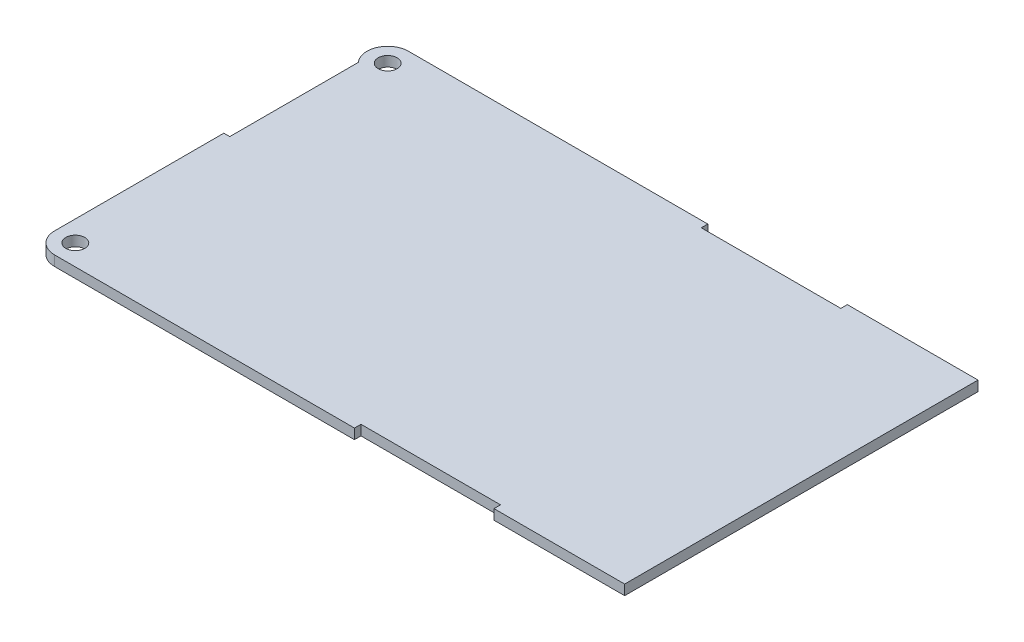
from build123d import *

# Parameters (mm, degrees)
SKETCH1_R           = 1.6
BOSS_EXTRUDE1_DEPTH = 1.7


with BuildPart() as part:
    # Sketch1 → Boss-Extrude1 (new body)
    with BuildSketch(Plane(origin=(0, 0, 0), x_dir=(1, 0, 0), z_dir=(0, 1, 0))):
        with BuildLine():
            ThreePointArc((0, 3.5), (1.025126266, 1.025126266), (3.5, 0))
            Line((3.5, 0), (54, 0))
            Line((54, 0), (54, 1.1))
            Line((54, 1.1), (77.5, 1.1))
            Line((77.5, 1.1), (77.5, 0))
            Line((77.5, 0), (99.5, 0))
            Line((99.5, 0), (99.5, 59.5))
            Line((99.5, 59.5), (77.5, 59.5))
            Line((77.5, 59.5), (77.5, 58.4))
            Line((77.5, 58.4), (54, 58.4))
            Line((54, 58.4), (54, 59.5))
            Line((54, 59.5), (3.6, 59.5))
            ThreePointArc((3.6, 59.5), (0.402285022, 57.422891043), (1, 53.656925097))
            Line((1, 53.656925097), (1, 32))
            Line((1, 32), (0, 32))
            Line((0, 32), (0, 3.5))
        make_face()
        with Locations((3.5, 3.5)):
            Circle(SKETCH1_R, mode=Mode.SUBTRACT)
        with Locations((3.6, 56)):
            Circle(SKETCH1_R, mode=Mode.SUBTRACT)
    extrude(amount=BOSS_EXTRUDE1_DEPTH)


solid = part.part
